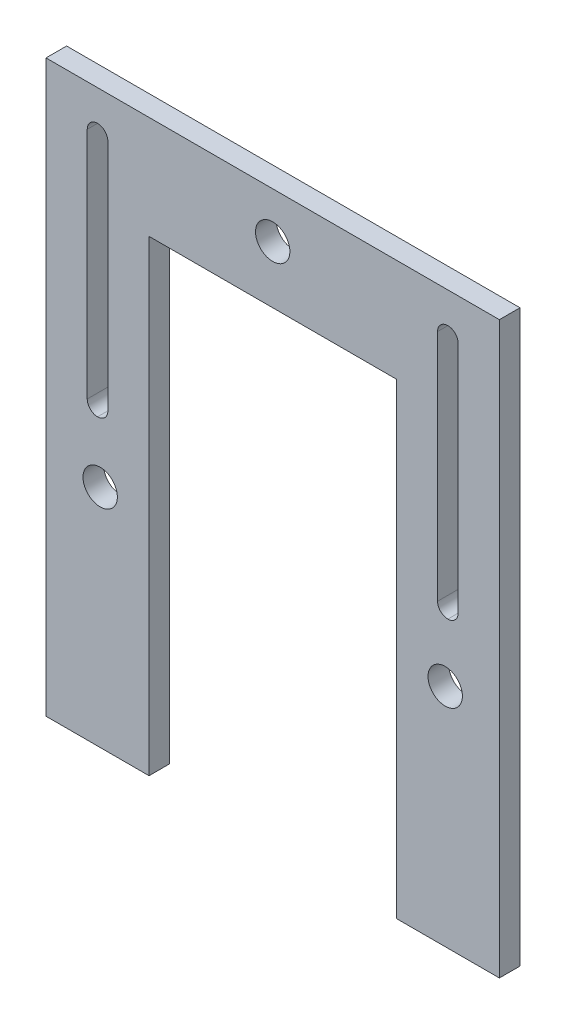
from build123d import *

# Parameters (mm, degrees)
SKETCH_1_R          = 2.5
EXTRUDE_1_DEPTH     = 3
SKETCH_2_W          = 3
SKETCH_2_H          = 37
CUT_EXTRUDE_1_DEPTH = 59.579181566
FILLET_1_R          = 1.5


with BuildPart() as part:
    # 草图1 → 凸台-拉伸1 (new body)
    with BuildSketch(Plane.XY):
        Polygon((-18, 19.693473392), (18, 19.693473392), (18, -48.306526608), (33, -48.306526608), (33, 34.693473392), (-33, 34.693473392), (-33, -48.306526608), (-18, -48.306526608), align=None)
        with Locations((0, 28.030377616)):
            Circle(SKETCH_1_R, mode=Mode.SUBTRACT)
        with Locations((25.11473671, -15.469622384)):
            Circle(SKETCH_1_R, mode=Mode.SUBTRACT)
        with Locations((-25.11473671, -15.469622384)):
            Circle(SKETCH_1_R, mode=Mode.SUBTRACT)
    extrude(amount=EXTRUDE_1_DEPTH)

    # 草图2 → 切除-拉伸1 (cut, through all)
    with BuildSketch(Plane.XY.offset(3)):
        with Locations((25.5, 11.693473392)):
            Rectangle(SKETCH_2_W, SKETCH_2_H)
        with Locations((-25.5, 11.693473392)):
            Rectangle(SKETCH_2_W, SKETCH_2_H)
    extrude(amount=-CUT_EXTRUDE_1_DEPTH, mode=Mode.SUBTRACT)

    # 圆角1
    fillet_1_edges = [part.edges().sort_by_distance(p)[0] for p in [
        (27, 30.193473392, 1.5),
        (24, 30.193473392, 1.5),
        (24, -6.806526608, 1.5),
        (27, -6.806526608, 1.5),
        (-24, -6.806526608, 1.5),
        (-27, -6.806526608, 1.5),
        (-24, 30.193473392, 1.5),
        (-27, 30.193473392, 1.5),
    ]]
    fillet(fillet_1_edges, radius=FILLET_1_R - 0.0001)  # a hair under: the kernel refuses the full size


solid = part.part
